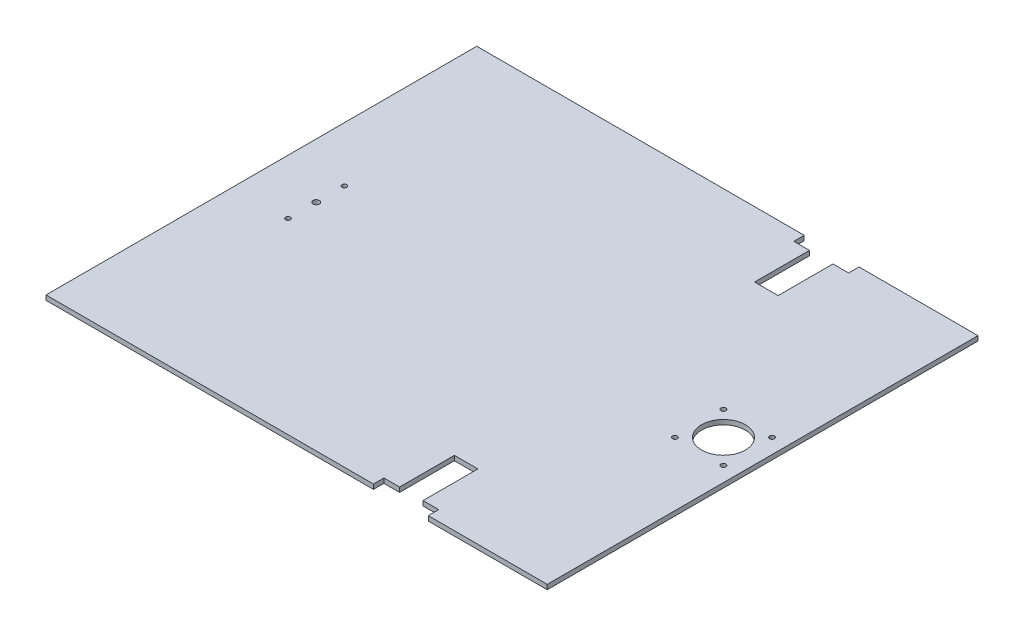
from build123d import *

# Parameters (mm, degrees)
SKETCH1_W                      = 320
SKETCH1_H                      = 275
BOSS_EXTRUDE1_DEPTH            = 3
TALADRO_DE_MARGEN_PARA_M2_51_D = 3.1
SKETCH6_R                      = 1.5
CUT_EXTRUDE1_DEPTH             = 211.986373968
SKETCH7_R                      = 14
CUT_EXTRUDE2_DEPTH             = 10
SKETCH8_R                      = 2
CUT_EXTRUDE3_DEPTH             = 10


with BuildPart() as part:
    # Sketch1 → Boss-Extrude1 (new body)
    with BuildSketch(Plane(origin=(0, 0, 0), x_dir=(1, 0, 0), z_dir=(0, 1, 0))):
        Rectangle(SKETCH1_W, SKETCH1_H)
    extrude(amount=BOSS_EXTRUDE1_DEPTH)

    # Taladro de margen para M2.51 (through all)
    with Locations(Plane(origin=(0, 3, 0), x_dir=(1, 0, 0), z_dir=(0, 1, 0))):
        with Locations((150.5, 15.5), (150.5, -15.5), (119.5, -15.5), (119.5, 15.5)):
            Hole(TALADRO_DE_MARGEN_PARA_M2_51_D / 2)

    # Sketch6 → Cut-Extrude1 (cut, through all)
    with BuildSketch(Plane(origin=(0, 3, 0), x_dir=(1, 0, 0), z_dir=(0, 1, 0))):
        with Locations((-125, -18)):
            Circle(SKETCH6_R)
        with Locations((-125, 18)):
            Circle(SKETCH6_R)
    extrude(amount=-CUT_EXTRUDE1_DEPTH, mode=Mode.SUBTRACT)

    # Sketch7 → Cut-Extrude2 (cut)
    with BuildSketch(Plane(origin=(0, 3, 0), x_dir=(1, 0, 0), z_dir=(0, 1, 0))):
        with Locations((135, -1e-09)):
            Circle(SKETCH7_R)
    extrude(amount=-CUT_EXTRUDE2_DEPTH, mode=Mode.SUBTRACT)

    # Sketch8 → Cut-Extrude3 (cut)
    with BuildSketch(Plane(origin=(0, 3, 0), x_dir=(1, 0, 0), z_dir=(0, 1, 0))):
        with Locations((-125, 0)):
            Circle(SKETCH8_R)
        Polygon((84.051704236, -137.5), (49.051704236, -137.5), (49.051704236, -130.827627619), (59.051704236, -130.827627619), (59.051704236, -95.827627619), (74.051704236, -95.827627619), (74.051704236, -130.827627619), (84.051704236, -130.827627619), align=None)
        Polygon((84.051704236, 137.5), (84.051704236, 130.827627619), (74.051704236, 130.827627619), (74.051704236, 95.827627619), (59.051704236, 95.827627619), (59.051704236, 130.827627619), (49.051704236, 130.827627619), (49.051704236, 137.5), align=None)
    extrude(amount=-CUT_EXTRUDE3_DEPTH, mode=Mode.SUBTRACT)


solid = part.part
